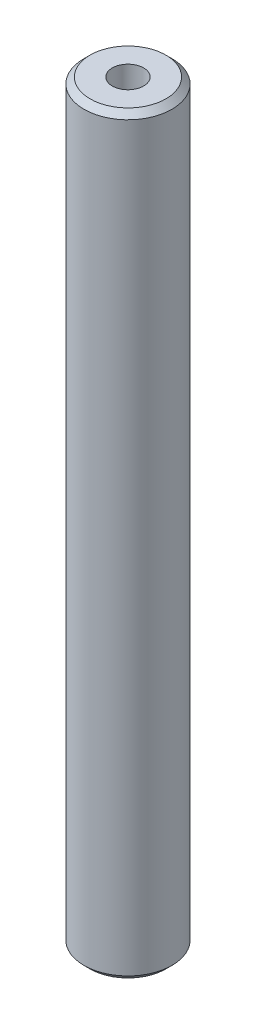
from build123d import *

# Parameters (mm, degrees)
SKETCH1_R           = 35
BOSS_EXTRUDE1_DEPTH = 600
SKETCH2_R           = 12.502069869
CUT_EXTRUDE1_DEPTH  = 603.038204768
CHAMFER1_SIZE       = 4.79773515


with BuildPart() as part:
    # Sketch1 → Boss-Extrude1 (new body)
    with BuildSketch(Plane(origin=(0, 0, 0), x_dir=(1, 0, 0), z_dir=(0, 1, 0))):
        Circle(SKETCH1_R)
    extrude(amount=BOSS_EXTRUDE1_DEPTH)

    # Sketch2 → Cut-Extrude1 (cut, through all)
    with BuildSketch(Plane(origin=(0, 0, 0), x_dir=(1, 0, 0), z_dir=(0, 1, 0))):
        Circle(SKETCH2_R)
    extrude(amount=CUT_EXTRUDE1_DEPTH, mode=Mode.SUBTRACT)

    # Chamfer1
    chamfer1_edges = [part.edges().sort_by_distance(p)[0] for p in [
        (-35, 600, 0),
        (-35, 0, 0),
    ]]
    chamfer(chamfer1_edges, length=CHAMFER1_SIZE)


solid = part.part
